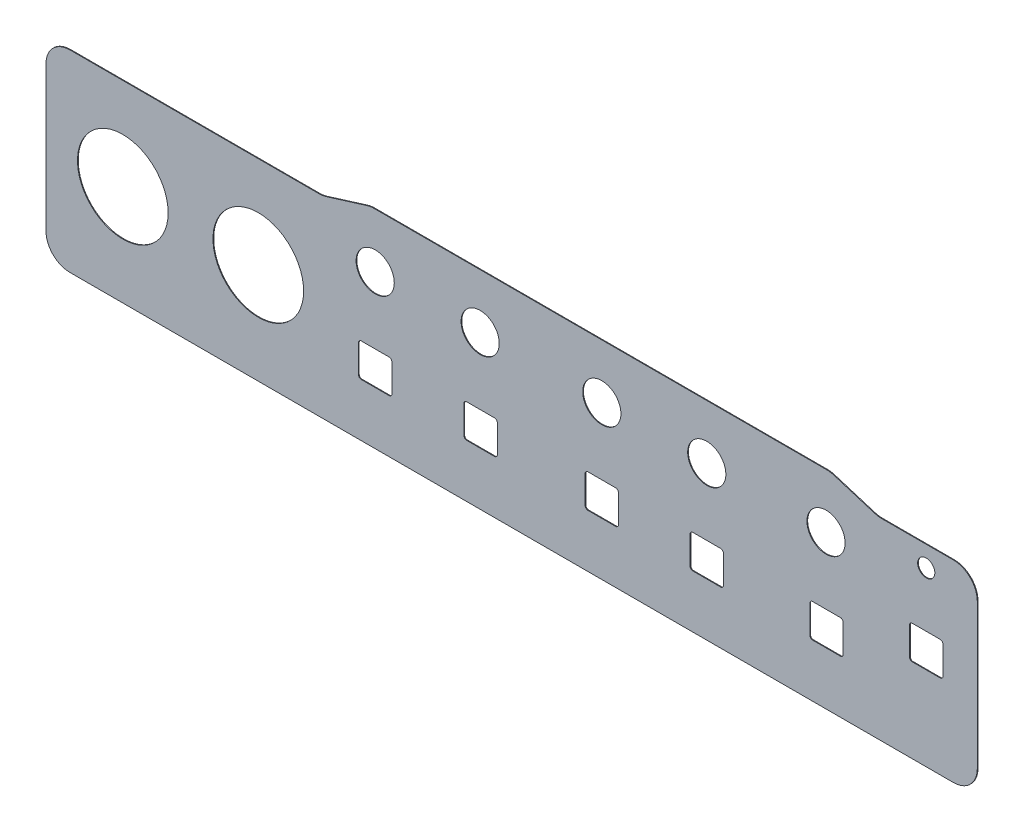
from build123d import *

# Parameters (mm, degrees)
PRINTED_FILM_START              = 15
PRINTED_FILM_DEPTH              = 0.15
OPENING_BNC_CHANNEL_0_START     = 15.25
OPENING_BNC_CHANNEL_0_PROFILE_R = 9.5
OPENING_BNC_CHANNEL_0_DEPTH     = 0.35
OPENING_BNC_CHANNEL_1_START     = 15.25
OPENING_BNC_CHANNEL_1_PROFILE_R = 9.5
OPENING_BNC_CHANNEL_1_DEPTH     = 0.35
OPENING_LED_RUN_START           = 15.25
OPENING_LED_RUN_PROFILE_R       = 1.8
OPENING_LED_RUN_DEPTH           = 0.35
OPENING_FUNC_START              = 15.25
OPENING_FUNC_PROFILE_R          = 4
OPENING_FUNC_DEPTH              = 0.35
OPENING_TRG_MODE_START          = 15.25
OPENING_TRG_MODE_DEPTH          = 0.35
OPENING_CURSOR_START            = 15.25
OPENING_CURSOR_DEPTH            = 0.35
OPENING_EN_CH1_START            = 15.25
OPENING_EN_CH1_DEPTH            = 0.35
OPENING_TRG_START               = 15.25
OPENING_TRG_PROFILE_R           = 4
OPENING_TRG_DEPTH               = 0.35
OPENING_TIME_START              = 15.25
OPENING_TIME_PROFILE_R          = 4
OPENING_TIME_DEPTH              = 0.35
OPENING_SET_CH1_START           = 15.25
OPENING_SET_CH1_PROFILE_R       = 4
OPENING_SET_CH1_DEPTH           = 0.35
OPENING_SET_CH0_START           = 15.25
OPENING_SET_CH0_PROFILE_R       = 4
OPENING_SET_CH0_DEPTH           = 0.35
OPENING_RUN_STOP_START          = 15.25
OPENING_RUN_STOP_DEPTH          = 0.35
OPENING_MENU_BACK_START         = 15.25
OPENING_MENU_BACK_DEPTH         = 0.35
OPENING_EN_CH0_START            = 15.25
OPENING_EN_CH0_DEPTH            = 0.35


with BuildPart() as part:
    # Printed_film_profile → Printed_film (new body)
    with BuildSketch(Plane.XY.offset(PRINTED_FILM_START)):
        with BuildLine():
            Line((2.4, -6.6), (187.6, -6.6))
            ThreePointArc((187.6, -6.6), (191.135533906, -5.135533906), (192.6, -1.6))
            Line((192.6, -1.6), (192.6, 28.8))
            ThreePointArc((192.6, 28.8), (191.135533906, 32.335533906), (187.6, 33.8))
            Line((187.6, 33.8), (172.557224923, 33.8))
            ThreePointArc((172.557224923, 33.8), (171.808537122, 33.856371113), (171.076731067, 34.024213369))
            Line((171.076731067, 34.024213369), (162.523268933, 36.675786631))
            ThreePointArc((162.523268933, 36.675786631), (161.791462878, 36.843628887), (161.042775077, 36.9))
            Line((161.042775077, 36.9), (66.157224923, 36.9))
            ThreePointArc((66.157224923, 36.9), (65.408537122, 36.843628887), (64.676731067, 36.675786631))
            Line((64.676731067, 36.675786631), (56.123268933, 34.024213369))
            ThreePointArc((56.123268933, 34.024213369), (55.391462878, 33.856371113), (54.642775077, 33.8))
            Line((54.642775077, 33.8), (2.4, 33.8))
            ThreePointArc((2.4, 33.8), (-1.135533906, 32.335533906), (-2.6, 28.8))
            Line((-2.6, 28.8), (-2.6, -1.6))
            ThreePointArc((-2.6, -1.6), (-1.135533906, -5.135533906), (2.4, -6.6))
        make_face()
    extrude(amount=PRINTED_FILM_DEPTH)

    # Opening_BNC_Channel_0_profile → Opening_BNC_Channel_0 (cut)
    with BuildSketch(Plane.XY.offset(OPENING_BNC_CHANNEL_0_START)):
        with Locations((13.5, 14.5)):
            Circle(OPENING_BNC_CHANNEL_0_PROFILE_R)
    extrude(amount=-OPENING_BNC_CHANNEL_0_DEPTH, mode=Mode.SUBTRACT)

    # Opening_BNC_Channel_1_profile → Opening_BNC_Channel_1 (cut)
    with BuildSketch(Plane.XY.offset(OPENING_BNC_CHANNEL_1_START)):
        with Locations((41.9, 14.5)):
            Circle(OPENING_BNC_CHANNEL_1_PROFILE_R)
    extrude(amount=-OPENING_BNC_CHANNEL_1_DEPTH, mode=Mode.SUBTRACT)

    # Opening_LED_RUN_profile → Opening_LED_RUN (cut)
    with BuildSketch(Plane.XY.offset(OPENING_LED_RUN_START)):
        with Locations((181.9, 29.5)):
            Circle(OPENING_LED_RUN_PROFILE_R)
    extrude(amount=-OPENING_LED_RUN_DEPTH, mode=Mode.SUBTRACT)

    # Opening_FUNC_profile → Opening_FUNC (cut)
    with BuildSketch(Plane.XY.offset(OPENING_FUNC_START)):
        with Locations((160.9, 25.5)):
            Circle(OPENING_FUNC_PROFILE_R)
    extrude(amount=-OPENING_FUNC_DEPTH, mode=Mode.SUBTRACT)

    # Opening_TRG_MODE_profile → Opening_TRG_MODE (cut)
    with BuildSketch(Plane.XY.offset(OPENING_TRG_MODE_START)):
        with BuildLine():
            Line((133, 4.5), (138.8, 4.5))
            ThreePointArc((138.8, 4.5), (139.224264069, 4.675735931), (139.4, 5.1))
            Line((139.4, 5.1), (139.4, 10.9))
            ThreePointArc((139.4, 10.9), (139.224264069, 11.324264069), (138.8, 11.5))
            Line((138.8, 11.5), (133, 11.5))
            ThreePointArc((133, 11.5), (132.575735931, 11.324264069), (132.4, 10.9))
            Line((132.4, 10.9), (132.4, 5.1))
            ThreePointArc((132.4, 5.1), (132.575735931, 4.675735931), (133, 4.5))
        make_face()
    extrude(amount=-OPENING_TRG_MODE_DEPTH, mode=Mode.SUBTRACT)

    # Opening_CURSOR_profile → Opening_CURSOR (cut)
    with BuildSketch(Plane.XY.offset(OPENING_CURSOR_START)):
        with BuildLine():
            Line((111, 4.5), (116.8, 4.5))
            ThreePointArc((116.8, 4.5), (117.224264069, 4.675735931), (117.4, 5.1))
            Line((117.4, 5.1), (117.4, 10.9))
            ThreePointArc((117.4, 10.9), (117.224264069, 11.324264069), (116.8, 11.5))
            Line((116.8, 11.5), (111, 11.5))
            ThreePointArc((111, 11.5), (110.575735931, 11.324264069), (110.4, 10.9))
            Line((110.4, 10.9), (110.4, 5.1))
            ThreePointArc((110.4, 5.1), (110.575735931, 4.675735931), (111, 4.5))
        make_face()
    extrude(amount=-OPENING_CURSOR_DEPTH, mode=Mode.SUBTRACT)

    # Opening_EN_CH1_profile → Opening_EN_CH1 (cut)
    with BuildSketch(Plane.XY.offset(OPENING_EN_CH1_START)):
        with BuildLine():
            Line((85.6, 4.5), (91.4, 4.5))
            ThreePointArc((91.4, 4.5), (91.824264069, 4.675735931), (92, 5.1))
            Line((92, 5.1), (92, 10.9))
            ThreePointArc((92, 10.9), (91.824264069, 11.324264069), (91.4, 11.5))
            Line((91.4, 11.5), (85.6, 11.5))
            ThreePointArc((85.6, 11.5), (85.175735931, 11.324264069), (85, 10.9))
            Line((85, 10.9), (85, 5.1))
            ThreePointArc((85, 5.1), (85.175735931, 4.675735931), (85.6, 4.5))
        make_face()
    extrude(amount=-OPENING_EN_CH1_DEPTH, mode=Mode.SUBTRACT)

    # Opening_TRG_profile → Opening_TRG (cut)
    with BuildSketch(Plane.XY.offset(OPENING_TRG_START)):
        with Locations((135.9, 25.5)):
            Circle(OPENING_TRG_PROFILE_R)
    extrude(amount=-OPENING_TRG_DEPTH, mode=Mode.SUBTRACT)

    # Opening_TIME_profile → Opening_TIME (cut)
    with BuildSketch(Plane.XY.offset(OPENING_TIME_START)):
        with Locations((113.9, 25.5)):
            Circle(OPENING_TIME_PROFILE_R)
    extrude(amount=-OPENING_TIME_DEPTH, mode=Mode.SUBTRACT)

    # Opening_SET_CH1_profile → Opening_SET_CH1 (cut)
    with BuildSketch(Plane.XY.offset(OPENING_SET_CH1_START)):
        with Locations((88.4, 25.5)):
            Circle(OPENING_SET_CH1_PROFILE_R)
    extrude(amount=-OPENING_SET_CH1_DEPTH, mode=Mode.SUBTRACT)

    # Opening_SET_CH0_profile → Opening_SET_CH0 (cut)
    with BuildSketch(Plane.XY.offset(OPENING_SET_CH0_START)):
        with Locations((66.4, 25.5)):
            Circle(OPENING_SET_CH0_PROFILE_R)
    extrude(amount=-OPENING_SET_CH0_DEPTH, mode=Mode.SUBTRACT)

    # Opening_RUN_STOP_profile → Opening_RUN_STOP (cut)
    with BuildSketch(Plane.XY.offset(OPENING_RUN_STOP_START)):
        with BuildLine():
            Line((179, 11), (184.8, 11))
            ThreePointArc((184.8, 11), (185.224264069, 11.175735931), (185.4, 11.6))
            Line((185.4, 11.6), (185.4, 17.4))
            ThreePointArc((185.4, 17.4), (185.224264069, 17.824264069), (184.8, 18))
            Line((184.8, 18), (179, 18))
            ThreePointArc((179, 18), (178.575735931, 17.824264069), (178.4, 17.4))
            Line((178.4, 17.4), (178.4, 11.6))
            ThreePointArc((178.4, 11.6), (178.575735931, 11.175735931), (179, 11))
        make_face()
    extrude(amount=-OPENING_RUN_STOP_DEPTH, mode=Mode.SUBTRACT)

    # Opening_MENU_BACK_profile → Opening_MENU_BACK (cut)
    with BuildSketch(Plane.XY.offset(OPENING_MENU_BACK_START)):
        with BuildLine():
            Line((158.1, 4.5), (163.9, 4.5))
            ThreePointArc((163.9, 4.5), (164.324264069, 4.675735931), (164.5, 5.1))
            Line((164.5, 5.1), (164.5, 10.9))
            ThreePointArc((164.5, 10.9), (164.324264069, 11.324264069), (163.9, 11.5))
            Line((163.9, 11.5), (158.1, 11.5))
            ThreePointArc((158.1, 11.5), (157.675735931, 11.324264069), (157.5, 10.9))
            Line((157.5, 10.9), (157.5, 5.1))
            ThreePointArc((157.5, 5.1), (157.675735931, 4.675735931), (158.1, 4.5))
        make_face()
    extrude(amount=-OPENING_MENU_BACK_DEPTH, mode=Mode.SUBTRACT)

    # Opening_EN_CH0_profile → Opening_EN_CH0 (cut)
    with BuildSketch(Plane.XY.offset(OPENING_EN_CH0_START)):
        with BuildLine():
            Line((63.5, 4.5), (69.3, 4.5))
            ThreePointArc((69.3, 4.5), (69.724264069, 4.675735931), (69.9, 5.1))
            Line((69.9, 5.1), (69.9, 10.9))
            ThreePointArc((69.9, 10.9), (69.724264069, 11.324264069), (69.3, 11.5))
            Line((69.3, 11.5), (63.5, 11.5))
            ThreePointArc((63.5, 11.5), (63.075735931, 11.324264069), (62.9, 10.9))
            Line((62.9, 10.9), (62.9, 5.1))
            ThreePointArc((62.9, 5.1), (63.075735931, 4.675735931), (63.5, 4.5))
        make_face()
    extrude(amount=-OPENING_EN_CH0_DEPTH, mode=Mode.SUBTRACT)


solid = part.part
